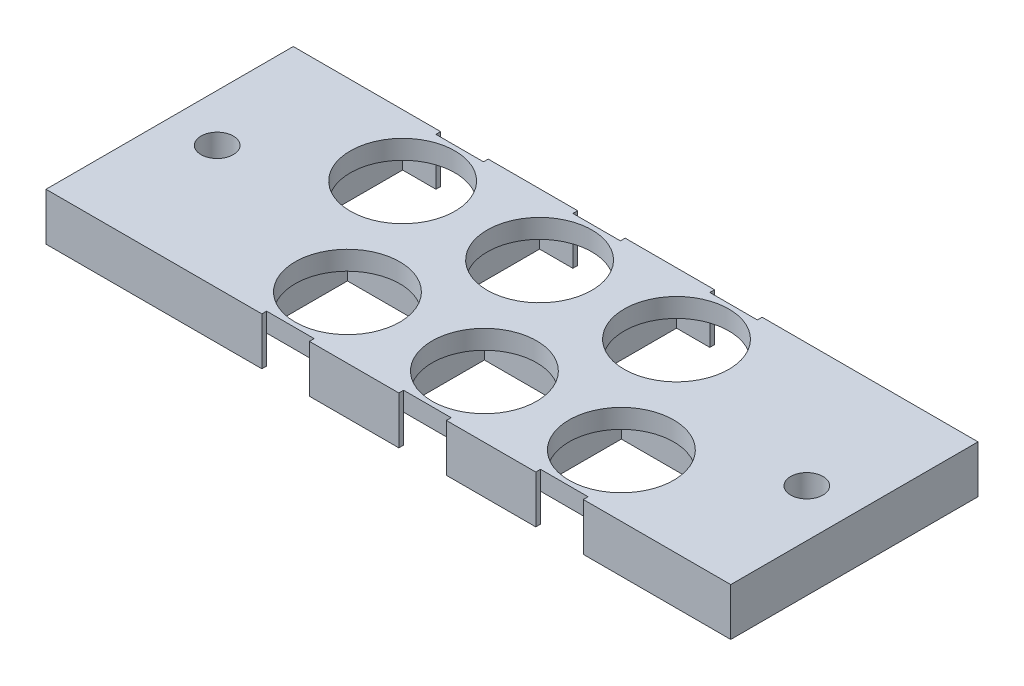
from build123d import *

# Parameters (mm, degrees)
SKETCH1_R             = 5.5
BOSS_EXTRUDE1_DEPTH   = 2
BOSS_EXTRUDE1_2_DEPTH = 2
BOSS_EXTRUDE1_3_DEPTH = 2
BOSS_EXTRUDE1_4_DEPTH = 2
BOSS_EXTRUDE1_5_DEPTH = 2
BOSS_EXTRUDE1_6_DEPTH = 2
SKETCH1_4_R           = 1.7
BOSS_EXTRUDE2_DEPTH   = 5
CUT_EXTRUDE2_DEPTH    = 1


with BuildPart() as part:
    # Sketch1 → Boss-Extrude1 (new body)
    with BuildSketch(Plane(origin=(0, 0, 0), x_dir=(1, 0, 0), z_dir=(0, 1, 0))):
        Polygon((5.686387511, -4.664883005), (-6.313612489, -4.664882988), (-6.313612506, -16.664882988), (5.686387494, -16.664883005), align=None)
        with Locations((-0.313612497, -10.664882997)):
            Circle(SKETCH1_R, mode=Mode.SUBTRACT)
    extrude(amount=-BOSS_EXTRUDE1_DEPTH)



with BuildPart() as body_2:
    # Sketch1 → Boss-Extrude1 2 (new body)
    with BuildSketch(Plane(origin=(0, 0, 0), x_dir=(1, 0, 0), z_dir=(0, 1, 0))):
        Polygon((20.086387511, -4.664883026), (8.086387511, -4.664883009), (8.086387494, -16.664883009), (20.086387494, -16.664883026), align=None)
        with Locations((14.086387503, -10.664883017)):
            Circle(SKETCH1_R, mode=Mode.SUBTRACT)
    extrude(amount=-BOSS_EXTRUDE1_2_DEPTH)


with BuildPart() as body_3:
    # Sketch1 → Boss-Extrude1 3 (new body)
    with BuildSketch(Plane(origin=(0, 0, 0), x_dir=(1, 0, 0), z_dir=(0, 1, 0))):
        Polygon((0.886387474, -29.664882999), (12.886387474, -29.664883016), (12.886387491, -17.664883016), (0.886387491, -17.664882999), align=None)
        with Locations((6.886387483, -23.664883007)):
            Circle(SKETCH1_R, mode=Mode.SUBTRACT)
    extrude(amount=-BOSS_EXTRUDE1_3_DEPTH)


with BuildPart() as body_4:
    # Sketch1 → Boss-Extrude1 4 (new body)
    with BuildSketch(Plane(origin=(0, 0, 0), x_dir=(1, 0, 0), z_dir=(0, 1, 0))):
        Polygon((15.286387474, -29.664883019), (27.286387474, -29.664883036), (27.286387491, -17.664883036), (15.286387491, -17.664883019), align=None)
        with Locations((21.286387483, -23.664883027)):
            Circle(SKETCH1_R, mode=Mode.SUBTRACT)
    extrude(amount=-BOSS_EXTRUDE1_4_DEPTH)


with BuildPart() as body_5:
    # Sketch1 → Boss-Extrude1 5 (new body)
    with BuildSketch(Plane(origin=(0, 0, 0), x_dir=(1, 0, 0), z_dir=(0, 1, 0))):
        Polygon((34.486387511, -4.664883046), (22.486387511, -4.664883029), (22.486387494, -16.664883029), (34.486387494, -16.664883046), align=None)
        with Locations((28.486387503, -10.664883038)):
            Circle(SKETCH1_R, mode=Mode.SUBTRACT)
    extrude(amount=-BOSS_EXTRUDE1_5_DEPTH)


with BuildPart() as body_6:
    # Sketch1 → Boss-Extrude1 6 (new body)
    with BuildSketch(Plane(origin=(0, 0, 0), x_dir=(1, 0, 0), z_dir=(0, 1, 0))):
        Polygon((29.686387474, -29.664883039), (41.686387474, -29.664883056), (41.686387491, -17.664883056), (29.686387491, -17.664883039), align=None)
        with Locations((35.686387483, -23.664883048)):
            Circle(SKETCH1_R, mode=Mode.SUBTRACT)
    extrude(amount=-BOSS_EXTRUDE1_6_DEPTH)


with BuildPart() as part_1:
    add(part.part)

    add(body_2.part)  # Boss-Extrude2 merges body 2

    add(body_3.part)  # Boss-Extrude2 merges body 3

    add(body_4.part)  # Boss-Extrude2 merges body 4

    add(body_5.part)  # Boss-Extrude2 merges body 5

    add(body_6.part)  # Boss-Extrude2 merges body 6
    # Sketch1<4> → Boss-Extrude2 (add)
    with BuildSketch(Plane(origin=(0, 0, 0), x_dir=(1, 0, 0), z_dir=(0, 1, 0))):
        Polygon((7.586387521, -4.164883013), (2.186387512, -4.164883), (2.186387511, -4.664883), (5.686387511, -4.664883005), (5.686387494, -16.664883005), (-6.313612506, -16.664882988), (-6.313612489, -4.664882988), (-2.813612489, -4.664882993), (-2.813612488, -4.164882993), (-6.813612488, -4.164882988), (-18.31361246, -4.164883002), (-18.31361246, -30.164883012), (0.386387502, -30.164883012), (4.386387474, -30.164883004), (4.386387474, -29.664883004), (0.886387474, -29.664882999), (0.886387491, -17.664882999), (12.886387491, -17.664883016), (12.886387474, -29.664883016), (9.386387474, -29.664883011), (9.386387474, -30.164883011), (13.386387474, -30.164883016), (14.786387502, -30.164883033), (18.786387474, -30.164883024), (18.786387474, -29.664883024), (15.286387474, -29.664883019), (15.286387491, -17.664883019), (27.286387491, -17.664883036), (27.286387474, -29.664883036), (23.786387474, -29.664883031), (23.786387474, -30.164883031), (27.786387474, -30.164883037), (29.186387502, -30.164883053), (33.186387474, -30.164883044), (33.186387474, -29.664883044), (29.686387474, -29.664883039), (29.686387491, -17.664883039), (41.686387491, -17.664883056), (41.686387474, -29.664883056), (38.186387474, -29.664883051), (38.186387474, -30.164883051), (42.186387474, -30.164883057), (53.686387503, -30.164883012), (53.686387503, -4.164883002), (34.98638754, -4.164883061), (30.986387512, -4.164883041), (30.986387511, -4.664883041), (34.486387511, -4.664883046), (34.486387494, -16.664883046), (22.486387494, -16.664883029), (22.486387511, -4.664883029), (25.986387511, -4.664883034), (25.986387512, -4.164883034), (21.986387512, -4.164883028), (20.58638754, -4.164883041), (16.586387512, -4.164883021), (16.586387511, -4.664883021), (20.086387511, -4.664883026), (20.086387494, -16.664883026), (8.086387494, -16.664883009), (8.086387511, -4.664883009), (11.586387511, -4.664883014), (11.586387512, -4.164883014), align=None)
        with Locations((-13.31361246, -17.164883007)):
            Circle(SKETCH1_4_R, mode=Mode.SUBTRACT)
        with Locations((48.68638754, -17.164883007)):
            Circle(SKETCH1_4_R, mode=Mode.SUBTRACT)
    extrude(amount=-BOSS_EXTRUDE2_DEPTH)

    # Sketch4 → Cut-Extrude2 (cut)
    with BuildSketch(Plane.XZ.offset(5)):
        Polygon((-9.718963701, 26.127659521), (-8.172168829, 26.127659521), (-8.172168829, 25.802018495), (-9.434027803, 25.802018495), (-9.434027803, 24.825095419), (-8.172168829, 24.825095419), (-8.172168829, 24.499454393), (-9.434027803, 24.499454393), (-9.434027803, 22.952659521), (-9.718963701, 22.952659521), align=None)
        Polygon((-7.212418228, 26.127659521), (-6.625373957, 26.127659521), (-6.625373957, 22.952659521), (-6.910309854, 22.952659521), (-6.910309854, 25.802018495), (-7.398771393, 25.802018495), align=None)
    extrude(amount=-CUT_EXTRUDE2_DEPTH, mode=Mode.SUBTRACT)


solid = part_1.part
